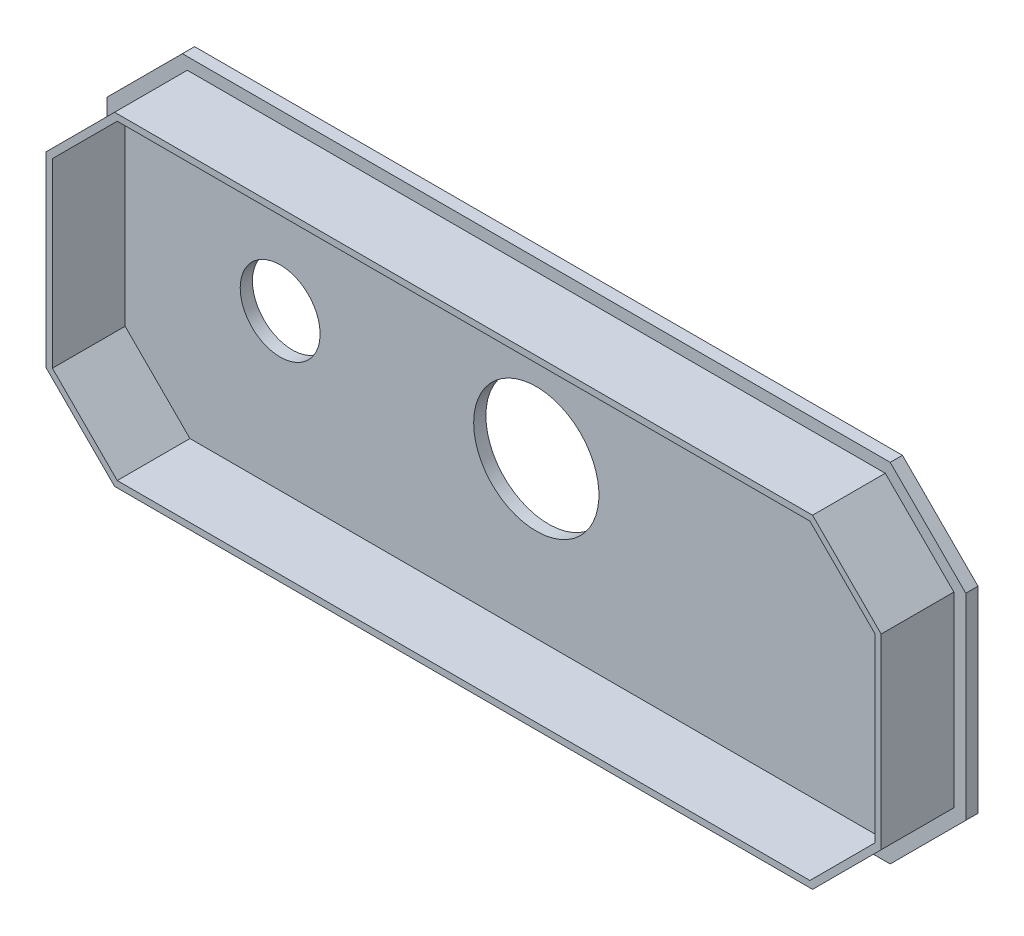
from build123d import *

# Parameters (mm, degrees)
SKETCH1_W           = 56.260800102
SKETCH1_H           = 22.783600102
BOSS_EXTRUDE1_DEPTH = 0.8
CUT_EXTRUDE1_DEPTH  = 31.360048014
BOSS_EXTRUDE2_DEPTH = 4.7625
SKETCH4_R           = 2.6162
CUT_EXTRUDE2_DEPTH  = 2.54
SKETCH5_R           = 4.1021
CUT_EXTRUDE3_DEPTH  = 2.54


with BuildPart() as part:
    # Sketch1 → Boss-Extrude1 (new body)
    with BuildSketch(Plane.XY):
        Rectangle(SKETCH1_W, SKETCH1_H)
    extrude(amount=BOSS_EXTRUDE1_DEPTH)

    # Sketch2 → Cut-Extrude1 (cut, through all)
    with BuildSketch(Plane.XY.offset(0.8)):
        Polygon((-28.130400051, -6.442052583), (-23.180652583, -11.391800051), (-28.130400051, -11.391800051), align=None)
        Polygon((-28.130400051, 6.442052583), (-23.180652583, 11.391800051), (-28.130400051, 11.391800051), align=None)
        Polygon((23.180652583, -11.391800051), (28.130400051, -6.442052583), (28.130400051, -11.391800051), align=None)
        Polygon((23.180652583, 11.391800051), (28.130400051, 6.442052583), (28.130400051, 11.391800051), align=None)
    extrude(amount=-CUT_EXTRUDE1_DEPTH, mode=Mode.SUBTRACT)

    # Sketch3 → Boss-Extrude2 (add)
    with BuildSketch(Plane.XY.offset(0.8)):
        Polygon((22.857566036, 10.611800127), (-22.857566036, 10.611800127), (-27.350400127, 6.118966036), (-27.350400127, -6.118966036), (-22.857566036, -10.611800127), (22.857566036, -10.611800127), (27.350400127, -6.118966036), (27.350400127, 6.118966036), align=None)
        Polygon((-22.683596339, 10.191800127), (-26.930400127, 5.944996339), (-26.930400127, -5.944996339), (-22.683596339, -10.191800127), (22.683596339, -10.191800127), (26.930400127, -5.944996339), (26.930400127, 5.944996339), (22.683596339, 10.191800127), align=None, mode=Mode.SUBTRACT)
    extrude(amount=BOSS_EXTRUDE2_DEPTH)

    # Sketch4 → Cut-Extrude2 (cut)
    with BuildSketch(Plane(origin=(0, 0, 0), x_dir=(-1, 0, 0), z_dir=(0, 0, -1))):
        with Locations((16.776600051, 0)):
            Circle(SKETCH4_R)
    extrude(amount=-CUT_EXTRUDE2_DEPTH, mode=Mode.SUBTRACT)

    # Sketch5 → Cut-Extrude3 (cut)
    with BuildSketch(Plane(origin=(0, 0, 0), x_dir=(-1, 0, 0), z_dir=(0, 0, -1))):
        Circle(SKETCH5_R)
    extrude(amount=-CUT_EXTRUDE3_DEPTH, mode=Mode.SUBTRACT)


solid = part.part
